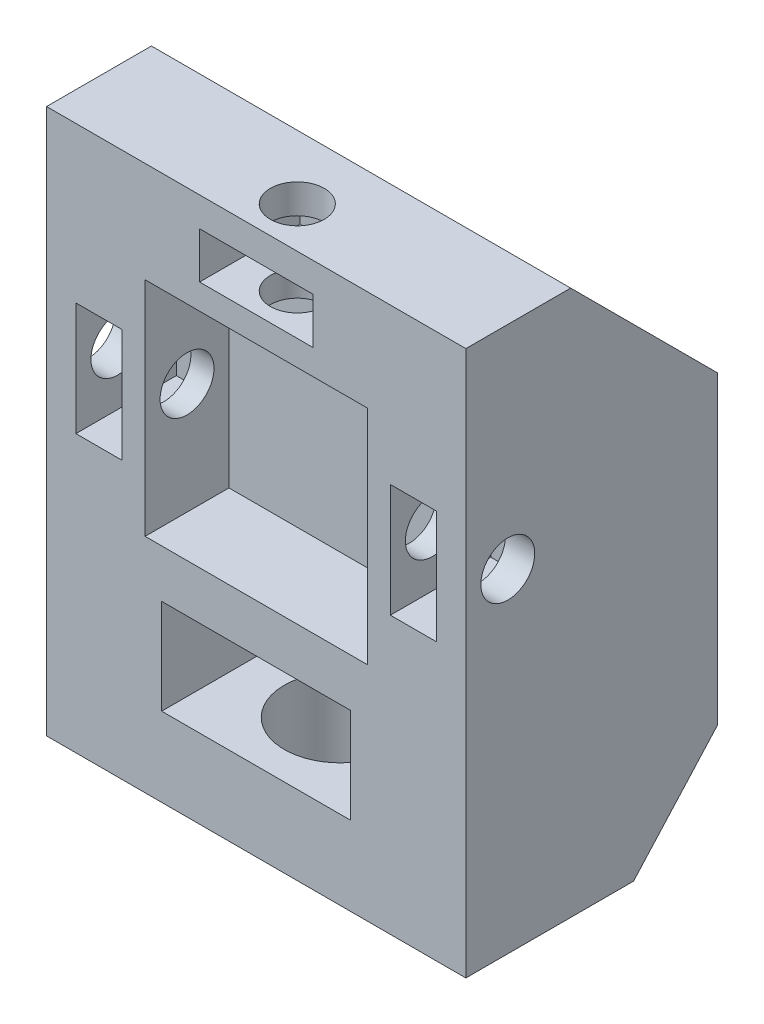
from build123d import *

# Parameters (mm, degrees)
SKETCH1_W                    = 25.4
SKETCH1_H                    = 33.02
BOSS_EXTRUDE1_DEPTH          = 15.24
SKETCH2_W                    = 13.462
SKETCH2_H                    = 13.462
CUT_EXTRUDE1_DEPTH           = 5.08
SKETCH3_W                    = 11.45304241
SKETCH3_H                    = 5.762537062
CUT_EXTRUDE2_DEPTH           = 26.80944982
CHAMFER1_SIZE                = 5.08
CHAMFER1_SIZE_2              = 5.641911575
F_1_4_CLEARANCE_HOLE1_REACH  = 40.521
F_1_4_CLEARANCE_HOLE1_BORE_R = 3.3782
F_4_CLEARANCE_HOLE1_D        = 3.2639
F_4_CLEARANCE_HOLE1_DEPTH    = 6.102100278
F_4_CLEARANCE_HOLE2_D        = 3.2639
CHAMFER2_SIZE                = 8.89
SKETCH11_W                   = 6.858
SKETCH11_H                   = 2.794
SKETCH11_W_2                 = 2.794
SKETCH11_H_2                 = 6.858
CUT_EXTRUDE3_DEPTH           = 6.0833


with BuildPart() as part:
    # Sketch1 → Boss-Extrude1 (new body)
    with BuildSketch(Plane.XY):
        Rectangle(SKETCH1_W, SKETCH1_H)
    extrude(amount=BOSS_EXTRUDE1_DEPTH)

    # Sketch2 → Cut-Extrude1 (cut)
    with BuildSketch(Plane.XY.offset(15.24)):
        with Locations((0, 3.676899722)):
            Rectangle(SKETCH2_W, SKETCH2_H)
    extrude(amount=-CUT_EXTRUDE1_DEPTH, mode=Mode.SUBTRACT)

    # Sketch3 → Cut-Extrude2 (cut, through all)
    with BuildSketch(Plane.XY.offset(15.24)):
        with Locations((0, -8.844079083)):
            Rectangle(SKETCH3_W, SKETCH3_H)
    extrude(amount=-CUT_EXTRUDE2_DEPTH, mode=Mode.SUBTRACT)

    # Chamfer1
    # the kernel refuses this chamfer: 5.641911575, 5.08 mm, written as the material it takes off along each edge
    with BuildSketch(Plane(origin=(-27.228960176, -16.51, 0), x_dir=(0, -0.03204434000819542, 0.9994864482690293), z_dir=(1, 0, 0))) as chamfer1_piece_1:
        Polygon((CHAMFER1_SIZE * 0.999486448269, -CHAMFER1_SIZE * 0.0320443400082), (-CHAMFER1_SIZE_2 * 0.0320443400101, -CHAMFER1_SIZE_2 * 0.999486448328), (0, 0), align=None)
    extrude(amount=54.457920352, mode=Mode.SUBTRACT)

    # 1/4 Clearance Hole1 bore → 1/4 Clearance Hole1 (cut, up to next)
    with BuildSketch(Plane(origin=(0, -16.51, 0), x_dir=(-1, 0, 0), z_dir=(0, -1, 0)), mode=Mode.PRIVATE) as f_1_4_clearance_hole1_sk1:
        with Locations((0, -10.16)):
            Circle(F_1_4_CLEARANCE_HOLE1_BORE_R)
    f_1_4_clearance_hole1_tool1 = extrude(f_1_4_clearance_hole1_sk1.sketch, amount=-F_1_4_CLEARANCE_HOLE1_REACH, mode=Mode.PRIVATE) & part.part
    add(f_1_4_clearance_hole1_tool1.solids().sort_by_distance((0, -16.51, 10.16))[0], mode=Mode.SUBTRACT)

    # #4 Clearance Hole1
    with Locations(Plane(origin=(0, 16.51, 0), x_dir=(1, 0, 0), z_dir=(0, 1, 0))):
        with Locations((0, -12.752259571)):
            Hole(F_4_CLEARANCE_HOLE1_D / 2, depth=F_4_CLEARANCE_HOLE1_DEPTH)

    # #4 Clearance Hole2 (through all)
    with Locations(Plane(origin=(12.7, 0, 0), x_dir=(0, 0, -1), z_dir=(1, 0, 0))):
        with Locations((-12.7, 3.676899722)):
            Hole(F_4_CLEARANCE_HOLE2_D / 2)

    # Chamfer2
    chamfer2_edges = [part.edges().sort_by_distance(p)[0] for p in [
        (0, 16.51, 0),
    ]]
    chamfer(chamfer2_edges, length=CHAMFER2_SIZE)

    # Sketch11 → Cut-Extrude3 (cut)
    with BuildSketch(Plane.XY.offset(15.24)):
        with Locations((0, 13.335)):
            Rectangle(SKETCH11_W, SKETCH11_H)
        with Locations((9.525, 3.667057181)):
            Rectangle(SKETCH11_W_2, SKETCH11_H_2)
        with Locations((-9.525, 3.667057181)):
            Rectangle(SKETCH11_W_2, SKETCH11_H_2)
    extrude(amount=-CUT_EXTRUDE3_DEPTH, mode=Mode.SUBTRACT)


solid = part.part
